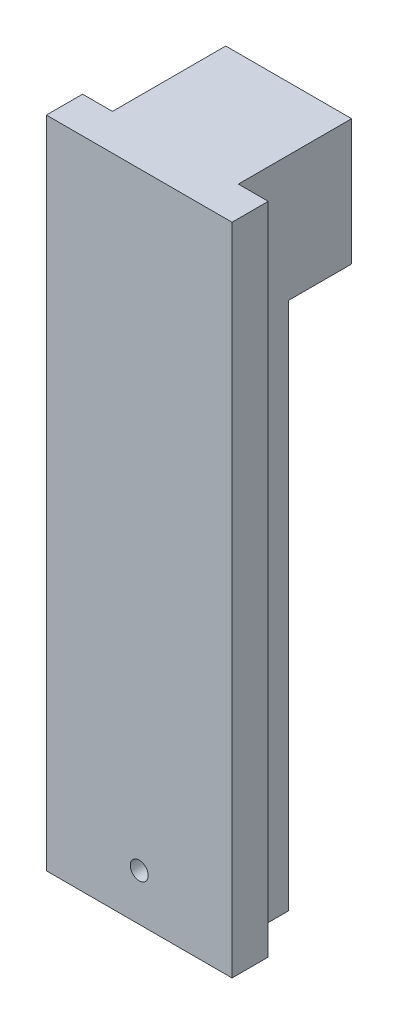
from build123d import *

# Parameters (mm, degrees)
DODANIE_WYCI_GNI_CIE1_DEPTH = 104
SZKIC2_W                    = 20
SZKIC2_H                    = 20
DODANIE_WYCI_GNI_CIE2_DEPTH = 10
SZKIC3_R                    = 2.5
WYTNIJ_WYCI_GNI_CIE1_DEPTH  = 10
SZKIC4_R                    = 1.425
WYTNIJ_WYCI_GNI_CIE2_DEPTH  = 108.692269918


with BuildPart() as part:
    # Szkic1 → Dodanie-wyciągnięcie1 (new body)
    with BuildSketch(Plane(origin=(0, 0, 0), x_dir=(1, 0, 0), z_dir=(0, 1, 0))):
        Polygon((-14.75, 0), (14.75, 0), (14.75, 5.75), (10, 5.75), (10, 13.75), (-10, 13.75), (-10, 5.75), (-14.75, 5.75), align=None)
    extrude(amount=DODANIE_WYCI_GNI_CIE1_DEPTH)

    # Szkic2 → Dodanie-wyciągnięcie2 (add)
    with BuildSketch(Plane(origin=(0, 0, -13.75), x_dir=(-1, 0, 0), z_dir=(0, 0, -1))):
        with Locations((0, 94)):
            Rectangle(SZKIC2_W, SZKIC2_H)
    extrude(amount=DODANIE_WYCI_GNI_CIE2_DEPTH)

    # Szkic3 → Wytnij-wyciągnięcie1 (cut)
    with BuildSketch(Plane(origin=(0, 0, -23.75), x_dir=(-1, 0, 0), z_dir=(0, 0, -1))):
        with Locations((0, 94)):
            Circle(SZKIC3_R)
    extrude(amount=-WYTNIJ_WYCI_GNI_CIE1_DEPTH, mode=Mode.SUBTRACT)

    # Szkic4 → Wytnij-wyciągnięcie2 (cut, through all)
    with BuildSketch(Plane.XY):
        with Locations((0, 7.425)):
            Circle(SZKIC4_R)
    extrude(amount=-WYTNIJ_WYCI_GNI_CIE2_DEPTH, mode=Mode.SUBTRACT)


solid = part.part
